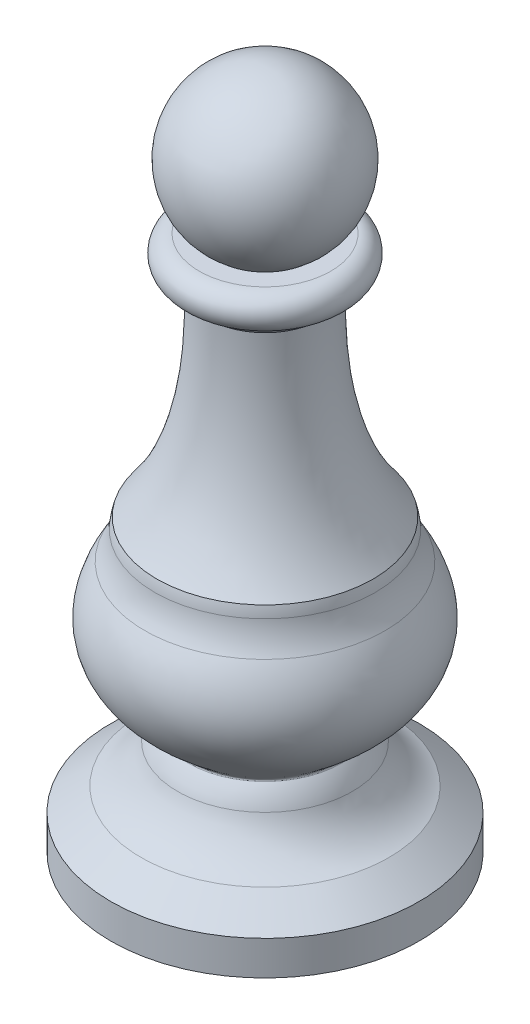
from build123d import *

# Parameters (mm, degrees)
SKETCH1_R           = 7.833333333
BOSS_EXTRUDE1_DEPTH = 5
FILLET3_R           = 5
SKETCH6_R           = 9.604677311
SKETCH5_R           = 5
SKETCH8_R           = 5
BOSS_EXTRUDE2_DEPTH = 10
SKETCH9_R           = 5
BOSS_EXTRUDE3_DEPTH = 1
BOSS_EXTRUDE3_DRAFT = -37
SKETCH13_R          = 10.833333333
BOSS_EXTRUDE4_DEPTH = 2
BOSS_EXTRUDE4_DRAFT = -53
FILLET7_R           = 6
FILLET8_R           = 6
FILLET9_R           = 6
SKETCH15_R          = 13.487422977
BOSS_EXTRUDE5_DEPTH = 3


with BuildPart() as part:
    # Sketch1 → Boss-Extrude1 (new body)
    with BuildSketch(Plane(origin=(0, 0, 0), x_dir=(1, 0, 0), z_dir=(0, 1, 0))):
        with Locations(Location((0, 0, 0), (0, 0, 270))):
            Circle(SKETCH1_R)
    extrude(amount=BOSS_EXTRUDE1_DEPTH)

    # Sketch2 → Revolve1 (revolve)
    with BuildSketch(Plane.XY):
        with BuildLine():
            Line((0, 5), (6.833333333, 5))
            add(Edge.make_bspline(
                [(6.833333333, 5), (5.112915615, 5.487208421), (18.272444449, 9.970961169), (7.637192214, 20.460360909), (7.604677311, 20.870272218)],
                knots=[0, 0, 0, 0, 0.888569417, 0.922130153, 0.922130153, 0.922130153, 0.922130153], degree=3))
            Line((7.604677311, 20.870272218), (0, 20.870272218))
            Line((0, 20.870272218), (0, 5))
        make_face()
    revolve(axis=Axis((0, 0, 0), (0, 1, 0)))

    # Fillet3
    # the kernel refuses this fillet: 5 mm, written as the material it takes off along each edge
    with BuildSketch(Plane(origin=(0, 5, 0), x_dir=(0, 0, 1), z_dir=(-1, 0, 0))) as fillet3_piece_1:
        with BuildLine():
            CenterArc((2.833333333, -3), FILLET3_R, 0, 36.869897646)
            Line((6.833333333, 0), (7.833333333, 0))
            Line((7.833333333, 0), (7.833333333, -3))
        make_face()
    revolve(axis=Axis((0, 5, 0), (0, 1, 0)), mode=Mode.SUBTRACT)

    # Sketch6 → Loft1 section 0
    with BuildSketch(Plane(origin=(0, 19.870272218, 0), x_dir=(1, 0, 0), z_dir=(0, 1, 0))):
        Circle(SKETCH6_R)
    # Sketch5 → Loft1 section 1
    with BuildSketch(Plane(origin=(0, 27.870272218, 0), x_dir=(1, 0, 0), z_dir=(0, 1, 0))):
        Circle(SKETCH5_R)
    loft()

    # Sketch8 → Boss-Extrude2 (add)
    with BuildSketch(Plane(origin=(0, 27.870272218, 0), x_dir=(1, 0, 0), z_dir=(0, 1, 0))):
        with Locations(Location((0, 0, 0), (0, 0, 180))):
            Circle(SKETCH8_R)
    extrude(amount=BOSS_EXTRUDE2_DEPTH)


with BuildPart() as boss_extrude3_tool:
    # Sketch9 → Boss-Extrude3 (with draft: the straight prism first)
    with BuildSketch(Plane(origin=(0, 37.870272218, 0), x_dir=(1, 0, 0), z_dir=(0, 1, 0))):
        with Locations(Location((0, 0, 0), (0, 0, 180))):
            Circle(SKETCH9_R)
    extrude(amount=BOSS_EXTRUDE3_DEPTH)
    # Boss-Extrude3: the draft: its side faces are tilted about the plane it starts from
    boss_extrude3_sides = [boss_extrude3_tool.faces().sort_by_distance(p)[0] for p in [
        (5, 38.370272218, 0),
    ]]
    draft(boss_extrude3_sides, Plane(origin=(0, 37.870272218, 0), x_dir=(1, 0, 0), z_dir=(0, 1, 0)), BOSS_EXTRUDE3_DRAFT)


with BuildPart() as part_1:
    add(part.part)

    # Boss-Extrude3: add boss_extrude3_tool
    add(boss_extrude3_tool.part)

    # Sketch10 → Revolve2 (revolve)
    with BuildSketch(Plane(origin=(0, 0, 0), x_dir=(0, 0, -1), z_dir=(1, 0, 0)), mode=Mode.PRIVATE) as revolve2_sk:
        with BuildLine():
            Line((0, 19.870272218), (9.604677326, 19.870272218))
            add(Edge.make_bspline(
                [(5, 37.870272218), (7.121771017, 28.575040847), (9.604677326, 19.870272218)],
                knots=[0, 0, 0, 0.621695863, 0.621695863, 0.621695863], degree=2))
            Line((5, 37.870272218), (0, 37.870272218))
            Line((0, 37.870272218), (0, 19.870272218))
        make_face()
    revolve(revolve2_sk.sketch.rotate(Axis((0, 37.870272218, 0), (0, -1, 0)), 270), axis=Axis((0, 37.870272218, 0), (0, -1, 0)))

    # Sketch11 → Revolve3 (revolve)
    with BuildSketch(Plane(origin=(0, 0, 0), x_dir=(0, 0, -1), z_dir=(1, 0, 0)), mode=Mode.PRIVATE) as revolve3_sk:
        with BuildLine():
            Line((5.75355405, 41.870272218), (0, 41.870272218))
            Line((0, 41.870272218), (0, 38.870272218))
            Line((0, 38.870272218), (5.75355405, 38.870272218))
            ThreePointArc((5.75355405, 38.870272218), (7.25355405, 40.370272218), (5.75355405, 41.870272218))
        make_face()
    revolve(revolve3_sk.sketch.rotate(Axis((0, 37.870272218, 0), (0, 1, 0)), 90), axis=Axis((0, 37.870272218, 0), (0, 1, 0)))

    # Sketch12 → Revolve4 (revolve)
    with BuildSketch(Plane(origin=(0, 0, 0), x_dir=(0, 0, -1), z_dir=(1, 0, 0))):
        with BuildLine():
            Line((0, 54.495864193), (0, 40.495864193))
            ThreePointArc((0, 40.495864193), (7, 47.495864193), (0, 54.495864193))
        make_face()
    revolve(axis=Axis((0, 54.495864193, 0), (0, -1, 0)))

    # Fillet6: read off the stored shape, not the designer's step
    # Fillet6 outline → Fillet6 (revolve)
    with BuildSketch(Plane.XY):
        with BuildLine():
            Line((9.604677326, 17.017137752), (10.506115086, 17.017137752))
            ThreePointArc((10.506115086, 17.017137752), (9.874687981, 18.38661086), (9.604677326, 19.870272219))
            Line((9.604677326, 19.870272219), (9.604677326, 17.017137752))
        make_face()
    revolve(axis=Axis((0, 0, 0), (0, 1, 0)))

    # Fillet6 2 outline → Fillet6 2 (revolve)
    with BuildSketch(Plane.XY):
        with BuildLine():
            add(Edge.make_bspline(
                [(9.604677326, 18.295115575), (9.246204709, 18.75185684), (8.793039383, 19.275136302), (8.274566582, 19.814898943), (8.22215024, 19.870272218)],
                knots=[0.845194733, 0.845194733, 0.845194733, 0.845194733, 0.888569417, 0.893504264, 0.893504264, 0.893504264, 0.893504264], degree=3))
            Line((9.604677326, 18.295115575), (9.604677326, 19.870272219))
            Line((9.604677326, 19.870272219), (8.22215024, 19.870272218))
        make_face()
    revolve(axis=Axis((0, 0, 0), (0, 1, 0)))


with BuildPart() as boss_extrude4_tool:
    # Sketch13 → Boss-Extrude4 (with draft: the straight prism first)
    with BuildSketch(Plane.XZ):
        Circle(SKETCH13_R)
    extrude(amount=BOSS_EXTRUDE4_DEPTH)
    # Boss-Extrude4: the draft: its side faces are tilted about the plane it starts from
    boss_extrude4_sides = [boss_extrude4_tool.faces().sort_by_distance(p)[0] for p in [
        (-10.833333333, -1, 0),
    ]]
    draft(boss_extrude4_sides, Plane.XZ, BOSS_EXTRUDE4_DRAFT)


with BuildPart() as part_2:
    add(part_1.part)

    # Boss-Extrude4: add boss_extrude4_tool
    add(boss_extrude4_tool.part)

    # Fillet7
    # the kernel refuses this fillet: 6 mm, written as the material it adds along each edge
    with BuildSketch(Plane(origin=(0, 0, 0), x_dir=(0, 0, 1), z_dir=(-1, 0, 0))) as fillet7_piece_1:
        with BuildLine():
            CenterArc((13.266911744, 5.484313642), FILLET7_R, 198.466841555, 47.604652304)
            Line((7.575868974, 3.583778928), (7.006764698, 3.393725457))
            ThreePointArc((7.006764698, 3.393725457), (7.233333333, 2), (7.233333333, 0))
            Line((7.233333333, 0), (7.833333333, -0.6))
            ThreePointArc((7.833333333, -0.6), (9.333333333, -0.6), (10.589975492, -0.548431364))
            Line((10.589975492, -0.548431364), (10.833333333, 0))
        make_face()
    revolve(axis=Axis((0, 0, 0), (0, 1, 0)))

    # Fillet8
    fillet8_edges = [part_2.edges().sort_by_distance(p)[0] for p in [
        (0, 19.870272218, -9.604677311),
    ]]
    fillet(fillet8_edges, radius=FILLET8_R)

    # Sketch14 → Cut-Revolve1 (revolve, cut)
    with BuildSketch(Plane.XY):
        with BuildLine():
            add(Edge.make_bspline(
                [(9.454164987, 20.399663383), (7.057318368, 28.857400383), (5, 37.870272218)],
                knots=[0.018885141, 0.018885141, 0.018885141, 0.621695863, 0.621695863, 0.621695863], degree=2))
            add(Edge.make_bspline(
                [(5, 37.870272218), (4.670764313, 26.304992773), (9.454164987, 20.399663383)],
                knots=[0, 0, 0, 0.759883207, 0.759883207, 0.759883207], degree=2))
        make_face()
    revolve(axis=Axis((0, 0, 0), (0, 1, 0)), mode=Mode.SUBTRACT)

    # Fillet9
    fillet9_edges = [part_2.edges().sort_by_distance(p)[0] for p in [
        (-4.831896338, 5, -4.831896338),
    ]]
    fillet(fillet9_edges, radius=FILLET9_R)

    # Sketch15 → Boss-Extrude5 (add)
    with BuildSketch(Plane.XZ.offset(2)):
        with Locations(Location((0, 0, 0), (0, 0, 270))):
            Circle(SKETCH15_R)
    extrude(amount=BOSS_EXTRUDE5_DEPTH)


solid = part_2.part
